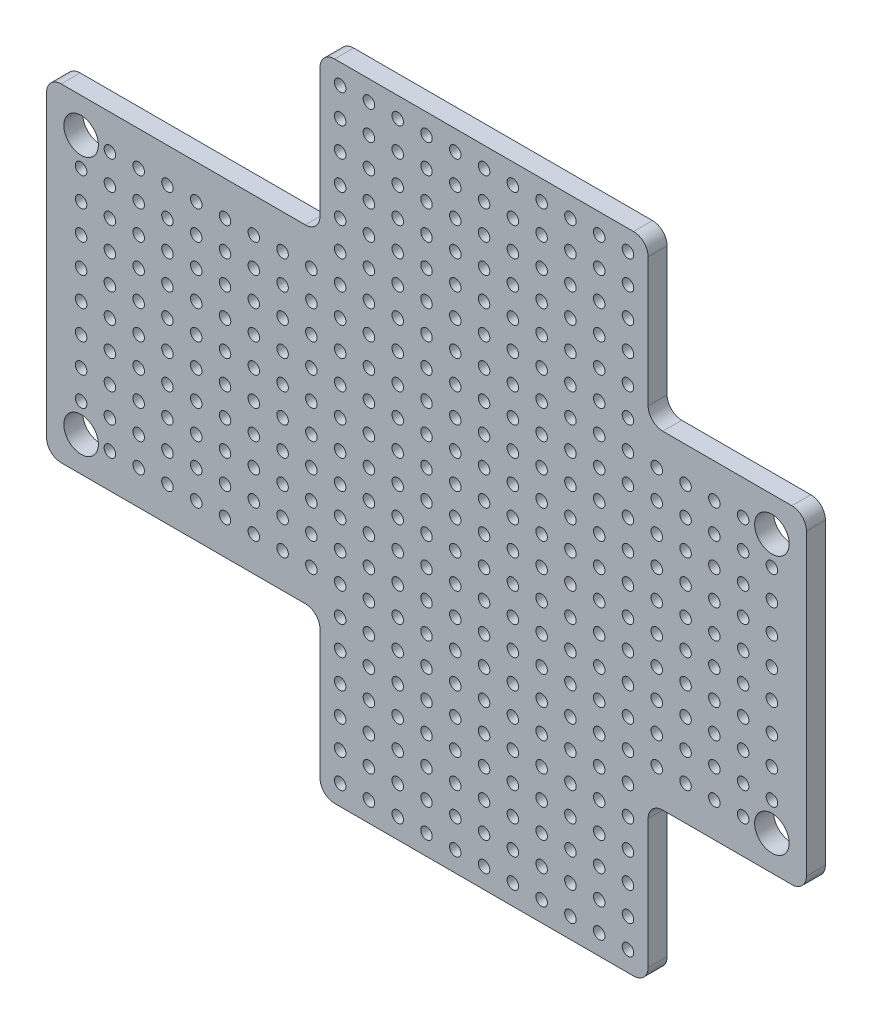
from build123d import *

# Parameters (mm, degrees)
SKETCH1_R           = 1.5
SKETCH1_R_2         = 0.5
BOSS_EXTRUDE1_DEPTH = 1.651
FILLET1_R           = 1.27


with BuildPart() as part:
    # Sketch1 → Boss-Extrude1 (new body)
    with BuildSketch(Plane.XY):
        Polygon((0, 0), (23.75, 0), (23.75, -13.75), (52.25, -13.75), (52.25, 0), (66, 0), (66, 28.5), (52.25, 28.5), (52.25, 42.25), (23.75, 42.25), (23.75, 28.5), (0, 28.5), align=None)
        with Locations((3, 25.5)):
            Circle(SKETCH1_R, mode=Mode.SUBTRACT)
        with Locations((63, 25.5)):
            Circle(SKETCH1_R, mode=Mode.SUBTRACT)
        with Locations((3, 3)):
            Circle(SKETCH1_R, mode=Mode.SUBTRACT)
        with Locations((63, 3)):
            Circle(SKETCH1_R, mode=Mode.SUBTRACT)
        with Locations((55.5, 5.5)):
            Circle(SKETCH1_R_2, mode=Mode.SUBTRACT)
        with Locations((5.5, 3)):
            Circle(SKETCH1_R_2, mode=Mode.SUBTRACT)
        with Locations((8, 3)):
            Circle(SKETCH1_R_2, mode=Mode.SUBTRACT)
        with Locations((10.5, 3)):
            Circle(SKETCH1_R_2, mode=Mode.SUBTRACT)
        with Locations((13, 3)):
            Circle(SKETCH1_R_2, mode=Mode.SUBTRACT)
        with Locations((15.5, 3)):
            Circle(SKETCH1_R_2, mode=Mode.SUBTRACT)
        with Locations((18, 3)):
            Circle(SKETCH1_R_2, mode=Mode.SUBTRACT)
        with Locations((20.5, 3)):
            Circle(SKETCH1_R_2, mode=Mode.SUBTRACT)
        with Locations((23, 3)):
            Circle(SKETCH1_R_2, mode=Mode.SUBTRACT)
        with Locations((25.5, 3)):
            Circle(SKETCH1_R_2, mode=Mode.SUBTRACT)
        with Locations((28, 3)):
            Circle(SKETCH1_R_2, mode=Mode.SUBTRACT)
        with Locations((30.5, 3)):
            Circle(SKETCH1_R_2, mode=Mode.SUBTRACT)
        with Locations((33, 3)):
            Circle(SKETCH1_R_2, mode=Mode.SUBTRACT)
        with Locations((35.5, 3)):
            Circle(SKETCH1_R_2, mode=Mode.SUBTRACT)
        with Locations((38, 3)):
            Circle(SKETCH1_R_2, mode=Mode.SUBTRACT)
        with Locations((40.5, 3)):
            Circle(SKETCH1_R_2, mode=Mode.SUBTRACT)
        with Locations((43, 3)):
            Circle(SKETCH1_R_2, mode=Mode.SUBTRACT)
        with Locations((45.5, 3)):
            Circle(SKETCH1_R_2, mode=Mode.SUBTRACT)
        with Locations((48, 3)):
            Circle(SKETCH1_R_2, mode=Mode.SUBTRACT)
        with Locations((50.5, 3)):
            Circle(SKETCH1_R_2, mode=Mode.SUBTRACT)
        with Locations((55.5, 10.5)):
            Circle(SKETCH1_R_2, mode=Mode.SUBTRACT)
        with Locations((55.5, 8)):
            Circle(SKETCH1_R_2, mode=Mode.SUBTRACT)
        with Locations((55.5, 15.5)):
            Circle(SKETCH1_R_2, mode=Mode.SUBTRACT)
        with Locations((55.5, 18)):
            Circle(SKETCH1_R_2, mode=Mode.SUBTRACT)
        with Locations((55.5, 20.5)):
            Circle(SKETCH1_R_2, mode=Mode.SUBTRACT)
        with Locations((55.5, 23)):
            Circle(SKETCH1_R_2, mode=Mode.SUBTRACT)
        with Locations((53, 3)):
            Circle(SKETCH1_R_2, mode=Mode.SUBTRACT)
        with Locations((53, 25.5)):
            Circle(SKETCH1_R_2, mode=Mode.SUBTRACT)
        with Locations((58, 5.5)):
            Circle(SKETCH1_R_2, mode=Mode.SUBTRACT)
        with Locations((5.5, 5.5)):
            Circle(SKETCH1_R_2, mode=Mode.SUBTRACT)
        with Locations((8, 5.5)):
            Circle(SKETCH1_R_2, mode=Mode.SUBTRACT)
        with Locations((10.5, 5.5)):
            Circle(SKETCH1_R_2, mode=Mode.SUBTRACT)
        with Locations((13, 5.5)):
            Circle(SKETCH1_R_2, mode=Mode.SUBTRACT)
        with Locations((15.5, 5.5)):
            Circle(SKETCH1_R_2, mode=Mode.SUBTRACT)
        with Locations((18, 5.5)):
            Circle(SKETCH1_R_2, mode=Mode.SUBTRACT)
        with Locations((20.5, 5.5)):
            Circle(SKETCH1_R_2, mode=Mode.SUBTRACT)
        with Locations((23, 5.5)):
            Circle(SKETCH1_R_2, mode=Mode.SUBTRACT)
        with Locations((25.5, 5.5)):
            Circle(SKETCH1_R_2, mode=Mode.SUBTRACT)
        with Locations((28, 5.5)):
            Circle(SKETCH1_R_2, mode=Mode.SUBTRACT)
        with Locations((30.5, 5.5)):
            Circle(SKETCH1_R_2, mode=Mode.SUBTRACT)
        with Locations((33, 5.5)):
            Circle(SKETCH1_R_2, mode=Mode.SUBTRACT)
        with Locations((35.5, 5.5)):
            Circle(SKETCH1_R_2, mode=Mode.SUBTRACT)
        with Locations((38, 5.5)):
            Circle(SKETCH1_R_2, mode=Mode.SUBTRACT)
        with Locations((40.5, 5.5)):
            Circle(SKETCH1_R_2, mode=Mode.SUBTRACT)
        with Locations((43, 5.5)):
            Circle(SKETCH1_R_2, mode=Mode.SUBTRACT)
        with Locations((45.5, 5.5)):
            Circle(SKETCH1_R_2, mode=Mode.SUBTRACT)
        with Locations((48, 5.5)):
            Circle(SKETCH1_R_2, mode=Mode.SUBTRACT)
        with Locations((50.5, 5.5)):
            Circle(SKETCH1_R_2, mode=Mode.SUBTRACT)
        with Locations((53, 5.5)):
            Circle(SKETCH1_R_2, mode=Mode.SUBTRACT)
        with Locations((58, 10.5)):
            Circle(SKETCH1_R_2, mode=Mode.SUBTRACT)
        with Locations((58, 8)):
            Circle(SKETCH1_R_2, mode=Mode.SUBTRACT)
        with Locations((58, 15.5)):
            Circle(SKETCH1_R_2, mode=Mode.SUBTRACT)
        with Locations((58, 18)):
            Circle(SKETCH1_R_2, mode=Mode.SUBTRACT)
        with Locations((58, 20.5)):
            Circle(SKETCH1_R_2, mode=Mode.SUBTRACT)
        with Locations((58, 23)):
            Circle(SKETCH1_R_2, mode=Mode.SUBTRACT)
        with Locations((55.5, 3)):
            Circle(SKETCH1_R_2, mode=Mode.SUBTRACT)
        with Locations((55.5, 25.5)):
            Circle(SKETCH1_R_2, mode=Mode.SUBTRACT)
        with Locations((5.5, 8)):
            Circle(SKETCH1_R_2, mode=Mode.SUBTRACT)
        with Locations((8, 8)):
            Circle(SKETCH1_R_2, mode=Mode.SUBTRACT)
        with Locations((10.5, 8)):
            Circle(SKETCH1_R_2, mode=Mode.SUBTRACT)
        with Locations((13, 8)):
            Circle(SKETCH1_R_2, mode=Mode.SUBTRACT)
        with Locations((15.5, 8)):
            Circle(SKETCH1_R_2, mode=Mode.SUBTRACT)
        with Locations((18, 8)):
            Circle(SKETCH1_R_2, mode=Mode.SUBTRACT)
        with Locations((20.5, 8)):
            Circle(SKETCH1_R_2, mode=Mode.SUBTRACT)
        with Locations((23, 8)):
            Circle(SKETCH1_R_2, mode=Mode.SUBTRACT)
        with Locations((25.5, 8)):
            Circle(SKETCH1_R_2, mode=Mode.SUBTRACT)
        with Locations((28, 8)):
            Circle(SKETCH1_R_2, mode=Mode.SUBTRACT)
        with Locations((30.5, 8)):
            Circle(SKETCH1_R_2, mode=Mode.SUBTRACT)
        with Locations((33, 8)):
            Circle(SKETCH1_R_2, mode=Mode.SUBTRACT)
        with Locations((35.5, 8)):
            Circle(SKETCH1_R_2, mode=Mode.SUBTRACT)
        with Locations((38, 8)):
            Circle(SKETCH1_R_2, mode=Mode.SUBTRACT)
        with Locations((40.5, 8)):
            Circle(SKETCH1_R_2, mode=Mode.SUBTRACT)
        with Locations((43, 8)):
            Circle(SKETCH1_R_2, mode=Mode.SUBTRACT)
        with Locations((45.5, 8)):
            Circle(SKETCH1_R_2, mode=Mode.SUBTRACT)
        with Locations((48, 8)):
            Circle(SKETCH1_R_2, mode=Mode.SUBTRACT)
        with Locations((50.5, 8)):
            Circle(SKETCH1_R_2, mode=Mode.SUBTRACT)
        with Locations((53, 8)):
            Circle(SKETCH1_R_2, mode=Mode.SUBTRACT)
        with Locations((60.5, 5.5)):
            Circle(SKETCH1_R_2, mode=Mode.SUBTRACT)
        with Locations((60.5, 10.5)):
            Circle(SKETCH1_R_2, mode=Mode.SUBTRACT)
        with Locations((60.5, 8)):
            Circle(SKETCH1_R_2, mode=Mode.SUBTRACT)
        with Locations((60.5, 15.5)):
            Circle(SKETCH1_R_2, mode=Mode.SUBTRACT)
        with Locations((60.5, 18)):
            Circle(SKETCH1_R_2, mode=Mode.SUBTRACT)
        with Locations((60.5, 20.5)):
            Circle(SKETCH1_R_2, mode=Mode.SUBTRACT)
        with Locations((60.5, 23)):
            Circle(SKETCH1_R_2, mode=Mode.SUBTRACT)
        with Locations((58, 3)):
            Circle(SKETCH1_R_2, mode=Mode.SUBTRACT)
        with Locations((5.5, 10.5)):
            Circle(SKETCH1_R_2, mode=Mode.SUBTRACT)
        with Locations((8, 10.5)):
            Circle(SKETCH1_R_2, mode=Mode.SUBTRACT)
        with Locations((10.5, 10.5)):
            Circle(SKETCH1_R_2, mode=Mode.SUBTRACT)
        with Locations((13, 10.5)):
            Circle(SKETCH1_R_2, mode=Mode.SUBTRACT)
        with Locations((15.5, 10.5)):
            Circle(SKETCH1_R_2, mode=Mode.SUBTRACT)
        with Locations((18, 10.5)):
            Circle(SKETCH1_R_2, mode=Mode.SUBTRACT)
        with Locations((20.5, 10.5)):
            Circle(SKETCH1_R_2, mode=Mode.SUBTRACT)
        with Locations((23, 10.5)):
            Circle(SKETCH1_R_2, mode=Mode.SUBTRACT)
        with Locations((25.5, 10.5)):
            Circle(SKETCH1_R_2, mode=Mode.SUBTRACT)
        with Locations((28, 10.5)):
            Circle(SKETCH1_R_2, mode=Mode.SUBTRACT)
        with Locations((30.5, 10.5)):
            Circle(SKETCH1_R_2, mode=Mode.SUBTRACT)
        with Locations((33, 10.5)):
            Circle(SKETCH1_R_2, mode=Mode.SUBTRACT)
        with Locations((35.5, 10.5)):
            Circle(SKETCH1_R_2, mode=Mode.SUBTRACT)
        with Locations((38, 10.5)):
            Circle(SKETCH1_R_2, mode=Mode.SUBTRACT)
        with Locations((40.5, 10.5)):
            Circle(SKETCH1_R_2, mode=Mode.SUBTRACT)
        with Locations((43, 10.5)):
            Circle(SKETCH1_R_2, mode=Mode.SUBTRACT)
        with Locations((45.5, 10.5)):
            Circle(SKETCH1_R_2, mode=Mode.SUBTRACT)
        with Locations((48, 10.5)):
            Circle(SKETCH1_R_2, mode=Mode.SUBTRACT)
        with Locations((50.5, 10.5)):
            Circle(SKETCH1_R_2, mode=Mode.SUBTRACT)
        with Locations((53, 10.5)):
            Circle(SKETCH1_R_2, mode=Mode.SUBTRACT)
        with Locations((58, 25.5)):
            Circle(SKETCH1_R_2, mode=Mode.SUBTRACT)
        with Locations((63, 5.5)):
            Circle(SKETCH1_R_2, mode=Mode.SUBTRACT)
        with Locations((63, 10.5)):
            Circle(SKETCH1_R_2, mode=Mode.SUBTRACT)
        with Locations((63, 8)):
            Circle(SKETCH1_R_2, mode=Mode.SUBTRACT)
        with Locations((63, 15.5)):
            Circle(SKETCH1_R_2, mode=Mode.SUBTRACT)
        with Locations((63, 18)):
            Circle(SKETCH1_R_2, mode=Mode.SUBTRACT)
        with Locations((63, 20.5)):
            Circle(SKETCH1_R_2, mode=Mode.SUBTRACT)
        with Locations((63, 23)):
            Circle(SKETCH1_R_2, mode=Mode.SUBTRACT)
        with Locations((5.5, 13)):
            Circle(SKETCH1_R_2, mode=Mode.SUBTRACT)
        with Locations((8, 13)):
            Circle(SKETCH1_R_2, mode=Mode.SUBTRACT)
        with Locations((10.5, 13)):
            Circle(SKETCH1_R_2, mode=Mode.SUBTRACT)
        with Locations((13, 13)):
            Circle(SKETCH1_R_2, mode=Mode.SUBTRACT)
        with Locations((15.5, 13)):
            Circle(SKETCH1_R_2, mode=Mode.SUBTRACT)
        with Locations((18, 13)):
            Circle(SKETCH1_R_2, mode=Mode.SUBTRACT)
        with Locations((20.5, 13)):
            Circle(SKETCH1_R_2, mode=Mode.SUBTRACT)
        with Locations((23, 13)):
            Circle(SKETCH1_R_2, mode=Mode.SUBTRACT)
        with Locations((25.5, 13)):
            Circle(SKETCH1_R_2, mode=Mode.SUBTRACT)
        with Locations((28, 13)):
            Circle(SKETCH1_R_2, mode=Mode.SUBTRACT)
        with Locations((30.5, 13)):
            Circle(SKETCH1_R_2, mode=Mode.SUBTRACT)
        with Locations((33, 13)):
            Circle(SKETCH1_R_2, mode=Mode.SUBTRACT)
        with Locations((35.5, 13)):
            Circle(SKETCH1_R_2, mode=Mode.SUBTRACT)
        with Locations((38, 13)):
            Circle(SKETCH1_R_2, mode=Mode.SUBTRACT)
        with Locations((40.5, 13)):
            Circle(SKETCH1_R_2, mode=Mode.SUBTRACT)
        with Locations((43, 13)):
            Circle(SKETCH1_R_2, mode=Mode.SUBTRACT)
        with Locations((45.5, 13)):
            Circle(SKETCH1_R_2, mode=Mode.SUBTRACT)
        with Locations((48, 13)):
            Circle(SKETCH1_R_2, mode=Mode.SUBTRACT)
        with Locations((50.5, 13)):
            Circle(SKETCH1_R_2, mode=Mode.SUBTRACT)
        with Locations((53, 13)):
            Circle(SKETCH1_R_2, mode=Mode.SUBTRACT)
        with Locations((60.5, 3)):
            Circle(SKETCH1_R_2, mode=Mode.SUBTRACT)
        with Locations((60.5, 25.5)):
            Circle(SKETCH1_R_2, mode=Mode.SUBTRACT)
        with Locations((55.5, 13)):
            Circle(SKETCH1_R_2, mode=Mode.SUBTRACT)
        with Locations((58, 13)):
            Circle(SKETCH1_R_2, mode=Mode.SUBTRACT)
        with Locations((60.5, 13)):
            Circle(SKETCH1_R_2, mode=Mode.SUBTRACT)
        with Locations((63, 13)):
            Circle(SKETCH1_R_2, mode=Mode.SUBTRACT)
        with Locations((5.5, 15.5)):
            Circle(SKETCH1_R_2, mode=Mode.SUBTRACT)
        with Locations((8, 15.5)):
            Circle(SKETCH1_R_2, mode=Mode.SUBTRACT)
        with Locations((10.5, 15.5)):
            Circle(SKETCH1_R_2, mode=Mode.SUBTRACT)
        with Locations((13, 15.5)):
            Circle(SKETCH1_R_2, mode=Mode.SUBTRACT)
        with Locations((15.5, 15.5)):
            Circle(SKETCH1_R_2, mode=Mode.SUBTRACT)
        with Locations((18, 15.5)):
            Circle(SKETCH1_R_2, mode=Mode.SUBTRACT)
        with Locations((20.5, 15.5)):
            Circle(SKETCH1_R_2, mode=Mode.SUBTRACT)
        with Locations((23, 15.5)):
            Circle(SKETCH1_R_2, mode=Mode.SUBTRACT)
        with Locations((25.5, 15.5)):
            Circle(SKETCH1_R_2, mode=Mode.SUBTRACT)
        with Locations((28, 15.5)):
            Circle(SKETCH1_R_2, mode=Mode.SUBTRACT)
        with Locations((30.5, 15.5)):
            Circle(SKETCH1_R_2, mode=Mode.SUBTRACT)
        with Locations((33, 15.5)):
            Circle(SKETCH1_R_2, mode=Mode.SUBTRACT)
        with Locations((35.5, 15.5)):
            Circle(SKETCH1_R_2, mode=Mode.SUBTRACT)
        with Locations((38, 15.5)):
            Circle(SKETCH1_R_2, mode=Mode.SUBTRACT)
        with Locations((40.5, 15.5)):
            Circle(SKETCH1_R_2, mode=Mode.SUBTRACT)
        with Locations((43, 15.5)):
            Circle(SKETCH1_R_2, mode=Mode.SUBTRACT)
        with Locations((45.5, 15.5)):
            Circle(SKETCH1_R_2, mode=Mode.SUBTRACT)
        with Locations((48, 15.5)):
            Circle(SKETCH1_R_2, mode=Mode.SUBTRACT)
        with Locations((50.5, 15.5)):
            Circle(SKETCH1_R_2, mode=Mode.SUBTRACT)
        with Locations((53, 15.5)):
            Circle(SKETCH1_R_2, mode=Mode.SUBTRACT)
        with Locations((5.5, 18)):
            Circle(SKETCH1_R_2, mode=Mode.SUBTRACT)
        with Locations((8, 18)):
            Circle(SKETCH1_R_2, mode=Mode.SUBTRACT)
        with Locations((10.5, 18)):
            Circle(SKETCH1_R_2, mode=Mode.SUBTRACT)
        with Locations((13, 18)):
            Circle(SKETCH1_R_2, mode=Mode.SUBTRACT)
        with Locations((15.5, 18)):
            Circle(SKETCH1_R_2, mode=Mode.SUBTRACT)
        with Locations((18, 18)):
            Circle(SKETCH1_R_2, mode=Mode.SUBTRACT)
        with Locations((20.5, 18)):
            Circle(SKETCH1_R_2, mode=Mode.SUBTRACT)
        with Locations((23, 18)):
            Circle(SKETCH1_R_2, mode=Mode.SUBTRACT)
        with Locations((25.5, 18)):
            Circle(SKETCH1_R_2, mode=Mode.SUBTRACT)
        with Locations((28, 18)):
            Circle(SKETCH1_R_2, mode=Mode.SUBTRACT)
        with Locations((30.5, 18)):
            Circle(SKETCH1_R_2, mode=Mode.SUBTRACT)
        with Locations((33, 18)):
            Circle(SKETCH1_R_2, mode=Mode.SUBTRACT)
        with Locations((35.5, 18)):
            Circle(SKETCH1_R_2, mode=Mode.SUBTRACT)
        with Locations((38, 18)):
            Circle(SKETCH1_R_2, mode=Mode.SUBTRACT)
        with Locations((40.5, 18)):
            Circle(SKETCH1_R_2, mode=Mode.SUBTRACT)
        with Locations((43, 18)):
            Circle(SKETCH1_R_2, mode=Mode.SUBTRACT)
        with Locations((45.5, 18)):
            Circle(SKETCH1_R_2, mode=Mode.SUBTRACT)
        with Locations((48, 18)):
            Circle(SKETCH1_R_2, mode=Mode.SUBTRACT)
        with Locations((50.5, 18)):
            Circle(SKETCH1_R_2, mode=Mode.SUBTRACT)
        with Locations((53, 18)):
            Circle(SKETCH1_R_2, mode=Mode.SUBTRACT)
        with Locations((5.5, 20.5)):
            Circle(SKETCH1_R_2, mode=Mode.SUBTRACT)
        with Locations((8, 20.5)):
            Circle(SKETCH1_R_2, mode=Mode.SUBTRACT)
        with Locations((10.5, 20.5)):
            Circle(SKETCH1_R_2, mode=Mode.SUBTRACT)
        with Locations((13, 20.5)):
            Circle(SKETCH1_R_2, mode=Mode.SUBTRACT)
        with Locations((15.5, 20.5)):
            Circle(SKETCH1_R_2, mode=Mode.SUBTRACT)
        with Locations((18, 20.5)):
            Circle(SKETCH1_R_2, mode=Mode.SUBTRACT)
        with Locations((20.5, 20.5)):
            Circle(SKETCH1_R_2, mode=Mode.SUBTRACT)
        with Locations((23, 20.5)):
            Circle(SKETCH1_R_2, mode=Mode.SUBTRACT)
        with Locations((25.5, 20.5)):
            Circle(SKETCH1_R_2, mode=Mode.SUBTRACT)
        with Locations((28, 20.5)):
            Circle(SKETCH1_R_2, mode=Mode.SUBTRACT)
        with Locations((30.5, 20.5)):
            Circle(SKETCH1_R_2, mode=Mode.SUBTRACT)
        with Locations((33, 20.5)):
            Circle(SKETCH1_R_2, mode=Mode.SUBTRACT)
        with Locations((35.5, 20.5)):
            Circle(SKETCH1_R_2, mode=Mode.SUBTRACT)
        with Locations((38, 20.5)):
            Circle(SKETCH1_R_2, mode=Mode.SUBTRACT)
        with Locations((40.5, 20.5)):
            Circle(SKETCH1_R_2, mode=Mode.SUBTRACT)
        with Locations((43, 20.5)):
            Circle(SKETCH1_R_2, mode=Mode.SUBTRACT)
        with Locations((45.5, 20.5)):
            Circle(SKETCH1_R_2, mode=Mode.SUBTRACT)
        with Locations((48, 20.5)):
            Circle(SKETCH1_R_2, mode=Mode.SUBTRACT)
        with Locations((50.5, 20.5)):
            Circle(SKETCH1_R_2, mode=Mode.SUBTRACT)
        with Locations((53, 20.5)):
            Circle(SKETCH1_R_2, mode=Mode.SUBTRACT)
        with Locations((5.5, 23)):
            Circle(SKETCH1_R_2, mode=Mode.SUBTRACT)
        with Locations((8, 23)):
            Circle(SKETCH1_R_2, mode=Mode.SUBTRACT)
        with Locations((10.5, 23)):
            Circle(SKETCH1_R_2, mode=Mode.SUBTRACT)
        with Locations((13, 23)):
            Circle(SKETCH1_R_2, mode=Mode.SUBTRACT)
        with Locations((15.5, 23)):
            Circle(SKETCH1_R_2, mode=Mode.SUBTRACT)
        with Locations((18, 23)):
            Circle(SKETCH1_R_2, mode=Mode.SUBTRACT)
        with Locations((20.5, 23)):
            Circle(SKETCH1_R_2, mode=Mode.SUBTRACT)
        with Locations((23, 23)):
            Circle(SKETCH1_R_2, mode=Mode.SUBTRACT)
        with Locations((25.5, 23)):
            Circle(SKETCH1_R_2, mode=Mode.SUBTRACT)
        with Locations((28, 23)):
            Circle(SKETCH1_R_2, mode=Mode.SUBTRACT)
        with Locations((30.5, 23)):
            Circle(SKETCH1_R_2, mode=Mode.SUBTRACT)
        with Locations((33, 23)):
            Circle(SKETCH1_R_2, mode=Mode.SUBTRACT)
        with Locations((35.5, 23)):
            Circle(SKETCH1_R_2, mode=Mode.SUBTRACT)
        with Locations((38, 23)):
            Circle(SKETCH1_R_2, mode=Mode.SUBTRACT)
        with Locations((40.5, 23)):
            Circle(SKETCH1_R_2, mode=Mode.SUBTRACT)
        with Locations((43, 23)):
            Circle(SKETCH1_R_2, mode=Mode.SUBTRACT)
        with Locations((45.5, 23)):
            Circle(SKETCH1_R_2, mode=Mode.SUBTRACT)
        with Locations((48, 23)):
            Circle(SKETCH1_R_2, mode=Mode.SUBTRACT)
        with Locations((50.5, 23)):
            Circle(SKETCH1_R_2, mode=Mode.SUBTRACT)
        with Locations((53, 23)):
            Circle(SKETCH1_R_2, mode=Mode.SUBTRACT)
        with Locations((5.5, 25.5)):
            Circle(SKETCH1_R_2, mode=Mode.SUBTRACT)
        with Locations((8, 25.5)):
            Circle(SKETCH1_R_2, mode=Mode.SUBTRACT)
        with Locations((10.5, 25.5)):
            Circle(SKETCH1_R_2, mode=Mode.SUBTRACT)
        with Locations((13, 25.5)):
            Circle(SKETCH1_R_2, mode=Mode.SUBTRACT)
        with Locations((15.5, 25.5)):
            Circle(SKETCH1_R_2, mode=Mode.SUBTRACT)
        with Locations((18, 25.5)):
            Circle(SKETCH1_R_2, mode=Mode.SUBTRACT)
        with Locations((20.5, 25.5)):
            Circle(SKETCH1_R_2, mode=Mode.SUBTRACT)
        with Locations((23, 25.5)):
            Circle(SKETCH1_R_2, mode=Mode.SUBTRACT)
        with Locations((25.5, 25.5)):
            Circle(SKETCH1_R_2, mode=Mode.SUBTRACT)
        with Locations((28, 25.5)):
            Circle(SKETCH1_R_2, mode=Mode.SUBTRACT)
        with Locations((30.5, 25.5)):
            Circle(SKETCH1_R_2, mode=Mode.SUBTRACT)
        with Locations((33, 25.5)):
            Circle(SKETCH1_R_2, mode=Mode.SUBTRACT)
        with Locations((35.5, 25.5)):
            Circle(SKETCH1_R_2, mode=Mode.SUBTRACT)
        with Locations((38, 25.5)):
            Circle(SKETCH1_R_2, mode=Mode.SUBTRACT)
        with Locations((40.5, 25.5)):
            Circle(SKETCH1_R_2, mode=Mode.SUBTRACT)
        with Locations((43, 25.5)):
            Circle(SKETCH1_R_2, mode=Mode.SUBTRACT)
        with Locations((45.5, 25.5)):
            Circle(SKETCH1_R_2, mode=Mode.SUBTRACT)
        with Locations((48, 25.5)):
            Circle(SKETCH1_R_2, mode=Mode.SUBTRACT)
        with Locations((50.5, 25.5)):
            Circle(SKETCH1_R_2, mode=Mode.SUBTRACT)
        with Locations((3, 5.5)):
            Circle(SKETCH1_R_2, mode=Mode.SUBTRACT)
        with Locations((3, 8)):
            Circle(SKETCH1_R_2, mode=Mode.SUBTRACT)
        with Locations((3, 10.5)):
            Circle(SKETCH1_R_2, mode=Mode.SUBTRACT)
        with Locations((3, 13)):
            Circle(SKETCH1_R_2, mode=Mode.SUBTRACT)
        with Locations((3, 15.5)):
            Circle(SKETCH1_R_2, mode=Mode.SUBTRACT)
        with Locations((3, 18)):
            Circle(SKETCH1_R_2, mode=Mode.SUBTRACT)
        with Locations((3, 20.5)):
            Circle(SKETCH1_R_2, mode=Mode.SUBTRACT)
        with Locations((3, 23)):
            Circle(SKETCH1_R_2, mode=Mode.SUBTRACT)
        with Locations((25.5, 28)):
            Circle(SKETCH1_R_2, mode=Mode.SUBTRACT)
        with Locations((28, 28)):
            Circle(SKETCH1_R_2, mode=Mode.SUBTRACT)
        with Locations((30.5, 28)):
            Circle(SKETCH1_R_2, mode=Mode.SUBTRACT)
        with Locations((33, 28)):
            Circle(SKETCH1_R_2, mode=Mode.SUBTRACT)
        with Locations((35.5, 28)):
            Circle(SKETCH1_R_2, mode=Mode.SUBTRACT)
        with Locations((38, 28)):
            Circle(SKETCH1_R_2, mode=Mode.SUBTRACT)
        with Locations((40.5, 28)):
            Circle(SKETCH1_R_2, mode=Mode.SUBTRACT)
        with Locations((43, 28)):
            Circle(SKETCH1_R_2, mode=Mode.SUBTRACT)
        with Locations((45.5, 28)):
            Circle(SKETCH1_R_2, mode=Mode.SUBTRACT)
        with Locations((48, 28)):
            Circle(SKETCH1_R_2, mode=Mode.SUBTRACT)
        with Locations((50.5, 28)):
            Circle(SKETCH1_R_2, mode=Mode.SUBTRACT)
        with Locations((25.5, 30.5)):
            Circle(SKETCH1_R_2, mode=Mode.SUBTRACT)
        with Locations((28, 30.5)):
            Circle(SKETCH1_R_2, mode=Mode.SUBTRACT)
        with Locations((30.5, 30.5)):
            Circle(SKETCH1_R_2, mode=Mode.SUBTRACT)
        with Locations((33, 30.5)):
            Circle(SKETCH1_R_2, mode=Mode.SUBTRACT)
        with Locations((35.5, 30.5)):
            Circle(SKETCH1_R_2, mode=Mode.SUBTRACT)
        with Locations((38, 30.5)):
            Circle(SKETCH1_R_2, mode=Mode.SUBTRACT)
        with Locations((40.5, 30.5)):
            Circle(SKETCH1_R_2, mode=Mode.SUBTRACT)
        with Locations((43, 30.5)):
            Circle(SKETCH1_R_2, mode=Mode.SUBTRACT)
        with Locations((45.5, 30.5)):
            Circle(SKETCH1_R_2, mode=Mode.SUBTRACT)
        with Locations((48, 30.5)):
            Circle(SKETCH1_R_2, mode=Mode.SUBTRACT)
        with Locations((50.5, 30.5)):
            Circle(SKETCH1_R_2, mode=Mode.SUBTRACT)
        with Locations((25.5, 33)):
            Circle(SKETCH1_R_2, mode=Mode.SUBTRACT)
        with Locations((28, 33)):
            Circle(SKETCH1_R_2, mode=Mode.SUBTRACT)
        with Locations((30.5, 33)):
            Circle(SKETCH1_R_2, mode=Mode.SUBTRACT)
        with Locations((33, 33)):
            Circle(SKETCH1_R_2, mode=Mode.SUBTRACT)
        with Locations((35.5, 33)):
            Circle(SKETCH1_R_2, mode=Mode.SUBTRACT)
        with Locations((38, 33)):
            Circle(SKETCH1_R_2, mode=Mode.SUBTRACT)
        with Locations((40.5, 33)):
            Circle(SKETCH1_R_2, mode=Mode.SUBTRACT)
        with Locations((43, 33)):
            Circle(SKETCH1_R_2, mode=Mode.SUBTRACT)
        with Locations((45.5, 33)):
            Circle(SKETCH1_R_2, mode=Mode.SUBTRACT)
        with Locations((48, 33)):
            Circle(SKETCH1_R_2, mode=Mode.SUBTRACT)
        with Locations((50.5, 33)):
            Circle(SKETCH1_R_2, mode=Mode.SUBTRACT)
        with Locations((25.5, 35.5)):
            Circle(SKETCH1_R_2, mode=Mode.SUBTRACT)
        with Locations((28, 35.5)):
            Circle(SKETCH1_R_2, mode=Mode.SUBTRACT)
        with Locations((30.5, 35.5)):
            Circle(SKETCH1_R_2, mode=Mode.SUBTRACT)
        with Locations((33, 35.5)):
            Circle(SKETCH1_R_2, mode=Mode.SUBTRACT)
        with Locations((35.5, 35.5)):
            Circle(SKETCH1_R_2, mode=Mode.SUBTRACT)
        with Locations((38, 35.5)):
            Circle(SKETCH1_R_2, mode=Mode.SUBTRACT)
        with Locations((40.5, 35.5)):
            Circle(SKETCH1_R_2, mode=Mode.SUBTRACT)
        with Locations((43, 35.5)):
            Circle(SKETCH1_R_2, mode=Mode.SUBTRACT)
        with Locations((45.5, 35.5)):
            Circle(SKETCH1_R_2, mode=Mode.SUBTRACT)
        with Locations((48, 35.5)):
            Circle(SKETCH1_R_2, mode=Mode.SUBTRACT)
        with Locations((50.5, 35.5)):
            Circle(SKETCH1_R_2, mode=Mode.SUBTRACT)
        with Locations((25.5, 38)):
            Circle(SKETCH1_R_2, mode=Mode.SUBTRACT)
        with Locations((28, 38)):
            Circle(SKETCH1_R_2, mode=Mode.SUBTRACT)
        with Locations((30.5, 38)):
            Circle(SKETCH1_R_2, mode=Mode.SUBTRACT)
        with Locations((33, 38)):
            Circle(SKETCH1_R_2, mode=Mode.SUBTRACT)
        with Locations((35.5, 38)):
            Circle(SKETCH1_R_2, mode=Mode.SUBTRACT)
        with Locations((38, 38)):
            Circle(SKETCH1_R_2, mode=Mode.SUBTRACT)
        with Locations((40.5, 38)):
            Circle(SKETCH1_R_2, mode=Mode.SUBTRACT)
        with Locations((43, 38)):
            Circle(SKETCH1_R_2, mode=Mode.SUBTRACT)
        with Locations((45.5, 38)):
            Circle(SKETCH1_R_2, mode=Mode.SUBTRACT)
        with Locations((48, 38)):
            Circle(SKETCH1_R_2, mode=Mode.SUBTRACT)
        with Locations((50.5, 38)):
            Circle(SKETCH1_R_2, mode=Mode.SUBTRACT)
        with Locations((25.5, 40.5)):
            Circle(SKETCH1_R_2, mode=Mode.SUBTRACT)
        with Locations((28, 40.5)):
            Circle(SKETCH1_R_2, mode=Mode.SUBTRACT)
        with Locations((30.5, 40.5)):
            Circle(SKETCH1_R_2, mode=Mode.SUBTRACT)
        with Locations((33, 40.5)):
            Circle(SKETCH1_R_2, mode=Mode.SUBTRACT)
        with Locations((35.5, 40.5)):
            Circle(SKETCH1_R_2, mode=Mode.SUBTRACT)
        with Locations((38, 40.5)):
            Circle(SKETCH1_R_2, mode=Mode.SUBTRACT)
        with Locations((40.5, 40.5)):
            Circle(SKETCH1_R_2, mode=Mode.SUBTRACT)
        with Locations((43, 40.5)):
            Circle(SKETCH1_R_2, mode=Mode.SUBTRACT)
        with Locations((45.5, 40.5)):
            Circle(SKETCH1_R_2, mode=Mode.SUBTRACT)
        with Locations((48, 40.5)):
            Circle(SKETCH1_R_2, mode=Mode.SUBTRACT)
        with Locations((50.5, 40.5)):
            Circle(SKETCH1_R_2, mode=Mode.SUBTRACT)
        with Locations((25.5, -12)):
            Circle(SKETCH1_R_2, mode=Mode.SUBTRACT)
        with Locations((25.5, -9.5)):
            Circle(SKETCH1_R_2, mode=Mode.SUBTRACT)
        with Locations((25.5, -7)):
            Circle(SKETCH1_R_2, mode=Mode.SUBTRACT)
        with Locations((25.5, -4.5)):
            Circle(SKETCH1_R_2, mode=Mode.SUBTRACT)
        with Locations((25.5, -2)):
            Circle(SKETCH1_R_2, mode=Mode.SUBTRACT)
        with Locations((25.5, 0.5)):
            Circle(SKETCH1_R_2, mode=Mode.SUBTRACT)
        with Locations((50.5, -12)):
            Circle(SKETCH1_R_2, mode=Mode.SUBTRACT)
        with Locations((48, -12)):
            Circle(SKETCH1_R_2, mode=Mode.SUBTRACT)
        with Locations((45.5, -12)):
            Circle(SKETCH1_R_2, mode=Mode.SUBTRACT)
        with Locations((43, -12)):
            Circle(SKETCH1_R_2, mode=Mode.SUBTRACT)
        with Locations((40.5, -12)):
            Circle(SKETCH1_R_2, mode=Mode.SUBTRACT)
        with Locations((38, -12)):
            Circle(SKETCH1_R_2, mode=Mode.SUBTRACT)
        with Locations((35.5, -12)):
            Circle(SKETCH1_R_2, mode=Mode.SUBTRACT)
        with Locations((33, -12)):
            Circle(SKETCH1_R_2, mode=Mode.SUBTRACT)
        with Locations((30.5, -12)):
            Circle(SKETCH1_R_2, mode=Mode.SUBTRACT)
        with Locations((28, -12)):
            Circle(SKETCH1_R_2, mode=Mode.SUBTRACT)
        with Locations((50.5, -9.5)):
            Circle(SKETCH1_R_2, mode=Mode.SUBTRACT)
        with Locations((48, -9.5)):
            Circle(SKETCH1_R_2, mode=Mode.SUBTRACT)
        with Locations((45.5, -9.5)):
            Circle(SKETCH1_R_2, mode=Mode.SUBTRACT)
        with Locations((43, -9.5)):
            Circle(SKETCH1_R_2, mode=Mode.SUBTRACT)
        with Locations((40.5, -9.5)):
            Circle(SKETCH1_R_2, mode=Mode.SUBTRACT)
        with Locations((38, -9.5)):
            Circle(SKETCH1_R_2, mode=Mode.SUBTRACT)
        with Locations((35.5, -9.5)):
            Circle(SKETCH1_R_2, mode=Mode.SUBTRACT)
        with Locations((33, -9.5)):
            Circle(SKETCH1_R_2, mode=Mode.SUBTRACT)
        with Locations((30.5, -9.5)):
            Circle(SKETCH1_R_2, mode=Mode.SUBTRACT)
        with Locations((28, -9.5)):
            Circle(SKETCH1_R_2, mode=Mode.SUBTRACT)
        with Locations((50.5, -7)):
            Circle(SKETCH1_R_2, mode=Mode.SUBTRACT)
        with Locations((48, -7)):
            Circle(SKETCH1_R_2, mode=Mode.SUBTRACT)
        with Locations((45.5, -7)):
            Circle(SKETCH1_R_2, mode=Mode.SUBTRACT)
        with Locations((43, -7)):
            Circle(SKETCH1_R_2, mode=Mode.SUBTRACT)
        with Locations((40.5, -7)):
            Circle(SKETCH1_R_2, mode=Mode.SUBTRACT)
        with Locations((38, -7)):
            Circle(SKETCH1_R_2, mode=Mode.SUBTRACT)
        with Locations((35.5, -7)):
            Circle(SKETCH1_R_2, mode=Mode.SUBTRACT)
        with Locations((33, -7)):
            Circle(SKETCH1_R_2, mode=Mode.SUBTRACT)
        with Locations((30.5, -7)):
            Circle(SKETCH1_R_2, mode=Mode.SUBTRACT)
        with Locations((28, -7)):
            Circle(SKETCH1_R_2, mode=Mode.SUBTRACT)
        with Locations((50.5, -4.5)):
            Circle(SKETCH1_R_2, mode=Mode.SUBTRACT)
        with Locations((48, -4.5)):
            Circle(SKETCH1_R_2, mode=Mode.SUBTRACT)
        with Locations((45.5, -4.5)):
            Circle(SKETCH1_R_2, mode=Mode.SUBTRACT)
        with Locations((43, -4.5)):
            Circle(SKETCH1_R_2, mode=Mode.SUBTRACT)
        with Locations((40.5, -4.5)):
            Circle(SKETCH1_R_2, mode=Mode.SUBTRACT)
        with Locations((38, -4.5)):
            Circle(SKETCH1_R_2, mode=Mode.SUBTRACT)
        with Locations((35.5, -4.5)):
            Circle(SKETCH1_R_2, mode=Mode.SUBTRACT)
        with Locations((33, -4.5)):
            Circle(SKETCH1_R_2, mode=Mode.SUBTRACT)
        with Locations((30.5, -4.5)):
            Circle(SKETCH1_R_2, mode=Mode.SUBTRACT)
        with Locations((28, -4.5)):
            Circle(SKETCH1_R_2, mode=Mode.SUBTRACT)
        with Locations((50.5, -2)):
            Circle(SKETCH1_R_2, mode=Mode.SUBTRACT)
        with Locations((48, -2)):
            Circle(SKETCH1_R_2, mode=Mode.SUBTRACT)
        with Locations((45.5, -2)):
            Circle(SKETCH1_R_2, mode=Mode.SUBTRACT)
        with Locations((43, -2)):
            Circle(SKETCH1_R_2, mode=Mode.SUBTRACT)
        with Locations((40.5, -2)):
            Circle(SKETCH1_R_2, mode=Mode.SUBTRACT)
        with Locations((38, -2)):
            Circle(SKETCH1_R_2, mode=Mode.SUBTRACT)
        with Locations((35.5, -2)):
            Circle(SKETCH1_R_2, mode=Mode.SUBTRACT)
        with Locations((33, -2)):
            Circle(SKETCH1_R_2, mode=Mode.SUBTRACT)
        with Locations((30.5, -2)):
            Circle(SKETCH1_R_2, mode=Mode.SUBTRACT)
        with Locations((28, -2)):
            Circle(SKETCH1_R_2, mode=Mode.SUBTRACT)
        with Locations((50.5, 0.5)):
            Circle(SKETCH1_R_2, mode=Mode.SUBTRACT)
        with Locations((48, 0.5)):
            Circle(SKETCH1_R_2, mode=Mode.SUBTRACT)
        with Locations((45.5, 0.5)):
            Circle(SKETCH1_R_2, mode=Mode.SUBTRACT)
        with Locations((43, 0.5)):
            Circle(SKETCH1_R_2, mode=Mode.SUBTRACT)
        with Locations((40.5, 0.5)):
            Circle(SKETCH1_R_2, mode=Mode.SUBTRACT)
        with Locations((38, 0.5)):
            Circle(SKETCH1_R_2, mode=Mode.SUBTRACT)
        with Locations((35.5, 0.5)):
            Circle(SKETCH1_R_2, mode=Mode.SUBTRACT)
        with Locations((33, 0.5)):
            Circle(SKETCH1_R_2, mode=Mode.SUBTRACT)
        with Locations((30.5, 0.5)):
            Circle(SKETCH1_R_2, mode=Mode.SUBTRACT)
        with Locations((28, 0.5)):
            Circle(SKETCH1_R_2, mode=Mode.SUBTRACT)
    extrude(amount=BOSS_EXTRUDE1_DEPTH)

    # Fillet1
    fillet1_edges = [part.edges().sort_by_distance(p)[0] for p in [
        (0, 28.5, 0.8255),
        (0, 0, 0.8255),
        (52.25, 42.25, 0.8255),
        (23.75, 42.25, 0.8255),
        (23.75, 28.5, 0.8255),
        (23.75, 0, 0.8255),
        (23.75, -13.75, 0.8255),
        (52.25, -13.75, 0.8255),
        (52.25, 28.5, 0.8255),
        (52.25, 0, 0.8255),
        (66, 28.5, 0.8255),
        (66, 0, 0.8255),
    ]]
    fillet(fillet1_edges, radius=FILLET1_R)


solid = part.part
